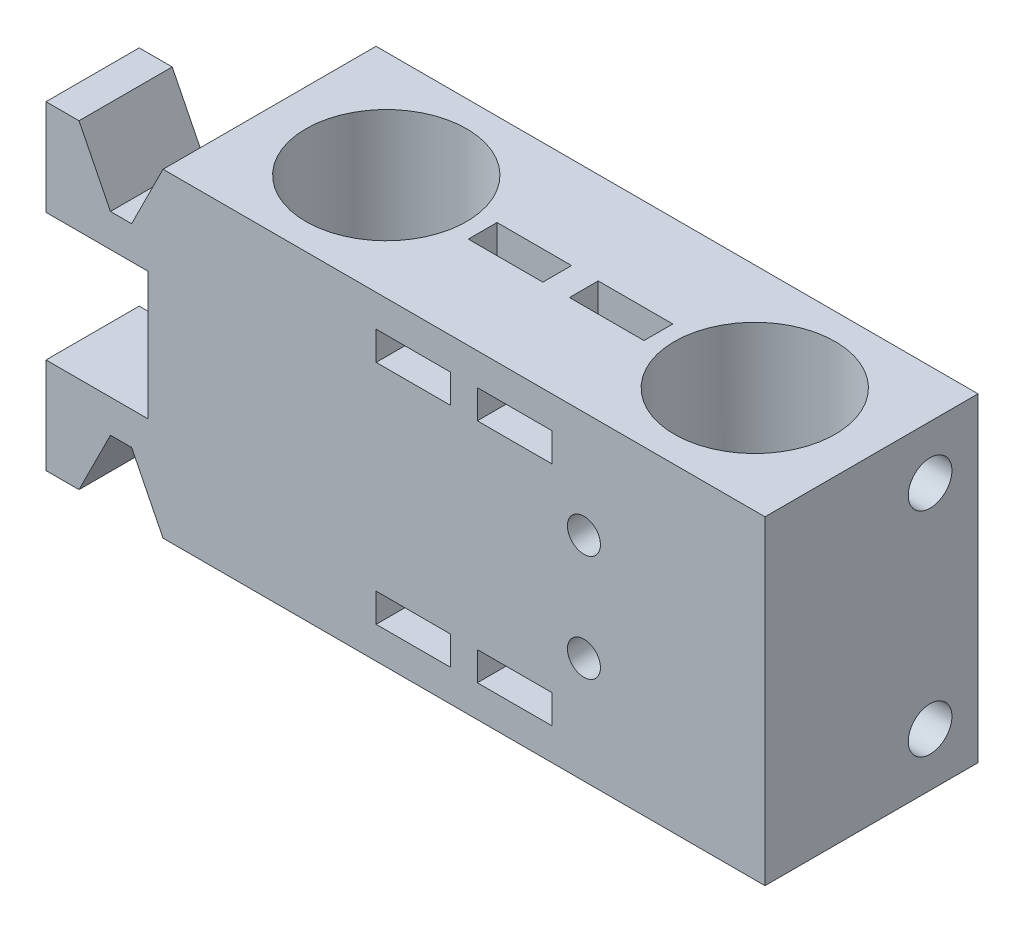
from build123d import *

# Parameters (mm, degrees)
BOSS_EXTRUDE1_DEPTH                     = 20
EARKNOTCH_SKETCH2_W                     = 10.99
EARKNOTCH_SKETCH2_H                     = 30
EARKNOTCH_CUT_EXTRUDE1_DEPTH            = 11.25
TOPHOLES_SKETCH3_R                      = 2.05
TOPHOLES_CUT_EXTRUDE2_DEPTH             = 4
FRONTHOLES_SKETCH1_R                    = 2.05
FRONTHOLES_CUT_EXTRUDE1_DEPTH           = 7
REARRIBBONHOLES_SKETCH2_W               = 7
REARRIBBONHOLES_SKETCH2_H               = 2.7
REARRIBBONHOLES_CUT_EXTRUDE1_DEPTH      = 11.35
RIGHTRIBBONHOLES_SKETCH4_W              = 7
RIGHTRIBBONHOLES_SKETCH4_H              = 2.7
RIGHTRIBBONHOLES_CUT_EXTRUDE2_DEPTH     = 5.7
LEFTRIBBONHOLES_SKETCH3_W               = 7
LEFTRIBBONHOLES_SKETCH3_H               = 2.7
LEFTRIBBONHOLES_CUT_EXTRUDE2_DEPTH      = 5.7
BOTTOMCLAMPMOUNTINGHOLESSKETCH3_R       = 2.05
BOTTOMCLAMPMOUNTHOLESCUT_EXTRUDE1_DEPTH = 4
LM8UUHOLESSKETCH1_R                     = 7.55
LM8UUCUT_EXTRUDE1_DEPTH                 = 77.534959986
RIBBONHOLEFILLET2_R                     = 2.7
RIBBONHOLEFILLET1_R                     = 2.7
RIBBONHOLEFILLET3_R                     = 2.7
RIBBONHOLEFILLET4_R                     = 2.7
PROBEMOUNTINGHOLESSKETCH1_R             = 1.55
PROBEMOUNTINGHOLESCUT_EXTRUDE1_DEPTH    = 3.1
LM8UUFASTENINGHOLESKETCH1_R             = 2.1
LM8UUFASTENINGHOLECUT_EXTRUDE1_DEPTH    = 14


with BuildPart() as part:
    # BackFace-Sketch1 → Boss-Extrude1 (new body)
    with BuildSketch(Plane.XY):
        Polygon((0, 0), (0, 9), (9.6, 9), (9.6, 21), (0, 21), (0, 30), (3.1, 30), (6.05, 24.095975949), (8.04, 24.095975949), (10.99, 30), (67.51, 30), (67.51, 0), (10.99, 0), (8.04, 5.904024051), (6.05, 5.904024051), (3.1, 0), align=None)
    extrude(amount=BOSS_EXTRUDE1_DEPTH)

    # EarKnotch-Sketch2 → EarKnotch-Cut-Extrude1 (cut)
    with BuildSketch(Plane(origin=(0, 0, 0), x_dir=(-1, 0, 0), z_dir=(0, 0, -1))):
        with Locations((-5.495, 15)):
            Rectangle(EARKNOTCH_SKETCH2_W, EARKNOTCH_SKETCH2_H)
    extrude(amount=-EARKNOTCH_CUT_EXTRUDE1_DEPTH, mode=Mode.SUBTRACT)

    # TopHoles-Sketch3 → TopHoles-Cut-Extrude2 (cut)
    with BuildSketch(Plane.ZY):
        with Locations((15.5, 25.5)):
            Circle(TOPHOLES_SKETCH3_R)
        with Locations((15.5, 4.5)):
            Circle(TOPHOLES_SKETCH3_R)
    extrude(amount=-TOPHOLES_CUT_EXTRUDE2_DEPTH, mode=Mode.SUBTRACT)

    # FrontHoles-Sketch1 → FrontHoles-Cut-Extrude1 (cut)
    with BuildSketch(Plane(origin=(0, 0, 0), x_dir=(-1, 0, 0), z_dir=(0, 0, -1))):
        with Locations((-43.86, 25)):
            Circle(FRONTHOLES_SKETCH1_R)
        with Locations((-43.86, 5)):
            Circle(FRONTHOLES_SKETCH1_R)
        with Locations((-31.86, 25)):
            Circle(FRONTHOLES_SKETCH1_R)
        with Locations((-31.86, 5)):
            Circle(FRONTHOLES_SKETCH1_R)
    extrude(amount=-FRONTHOLES_CUT_EXTRUDE1_DEPTH, mode=Mode.SUBTRACT)

    # RearRibbonHoles-Sketch2 → RearRibbonHoles-Cut-Extrude1 (cut)
    with BuildSketch(Plane.XY.offset(20)):
        with Locations((34.5, 25.65)):
            Rectangle(REARRIBBONHOLES_SKETCH2_W, REARRIBBONHOLES_SKETCH2_H)
        with Locations((44, 25.65)):
            Rectangle(REARRIBBONHOLES_SKETCH2_W, REARRIBBONHOLES_SKETCH2_H)
        with Locations((34.5, 4.35)):
            Rectangle(REARRIBBONHOLES_SKETCH2_W, REARRIBBONHOLES_SKETCH2_H)
        with Locations((44, 4.35)):
            Rectangle(REARRIBBONHOLES_SKETCH2_W, REARRIBBONHOLES_SKETCH2_H)
    extrude(amount=-REARRIBBONHOLES_CUT_EXTRUDE1_DEPTH, mode=Mode.SUBTRACT)

    # RightRibbonHoles-Sketch4 → RightRibbonHoles-Cut-Extrude2 (cut)
    with BuildSketch(Plane(origin=(0, 30, 0), x_dir=(1, 0, 0), z_dir=(0, 1, 0))):
        with Locations((34.5, -10)):
            Rectangle(RIGHTRIBBONHOLES_SKETCH4_W, RIGHTRIBBONHOLES_SKETCH4_H)
        with Locations((44, -10)):
            Rectangle(RIGHTRIBBONHOLES_SKETCH4_W, RIGHTRIBBONHOLES_SKETCH4_H)
    extrude(amount=-RIGHTRIBBONHOLES_CUT_EXTRUDE2_DEPTH, mode=Mode.SUBTRACT)

    # LeftRibbonHoles-Sketch3 → LeftRibbonHoles-Cut-Extrude2 (cut)
    with BuildSketch(Plane.XZ):
        with Locations((34.5, 10)):
            Rectangle(LEFTRIBBONHOLES_SKETCH3_W, LEFTRIBBONHOLES_SKETCH3_H)
        with Locations((44, 10)):
            Rectangle(LEFTRIBBONHOLES_SKETCH3_W, LEFTRIBBONHOLES_SKETCH3_H)
    extrude(amount=-LEFTRIBBONHOLES_CUT_EXTRUDE2_DEPTH, mode=Mode.SUBTRACT)

    # BottomClampMountingHolesSketch3 → BottomClampMountHolesCut-Extrude1 (cut)
    with BuildSketch(Plane(origin=(67.51, 0, 0), x_dir=(0, 0, -1), z_dir=(1, 0, 0))):
        with Locations((-4.5, 25)):
            Circle(BOTTOMCLAMPMOUNTINGHOLESSKETCH3_R)
        with Locations((-4.5, 5)):
            Circle(BOTTOMCLAMPMOUNTINGHOLESSKETCH3_R)
    extrude(amount=-BOTTOMCLAMPMOUNTHOLESCUT_EXTRUDE1_DEPTH, mode=Mode.SUBTRACT)

    # LM8UUHolesSketch1 → LM8UUCut-Extrude1 (cut, through all)
    with BuildSketch(Plane(origin=(0, 30, 0), x_dir=(1, 0, 0), z_dir=(0, 1, 0))):
        with Locations((21.95, -10)):
            Circle(LM8UUHOLESSKETCH1_R)
        with Locations((56.55, -10)):
            Circle(LM8UUHOLESSKETCH1_R)
    extrude(amount=-LM8UUCUT_EXTRUDE1_DEPTH, mode=Mode.SUBTRACT)

    # RibbonHoleFillet2
    ribbonholefillet2_edges = [part.edges().sort_by_distance(p)[0] for p in [
        (34.5, 5.7, 8.65),
    ]]
    fillet(ribbonholefillet2_edges, radius=RIBBONHOLEFILLET2_R)

    # RibbonHoleFillet1
    ribbonholefillet1_edges = [part.edges().sort_by_distance(p)[0] for p in [
        (44, 5.7, 8.65),
    ]]
    fillet(ribbonholefillet1_edges, radius=RIBBONHOLEFILLET1_R)

    # RibbonHoleFillet3
    ribbonholefillet3_edges = [part.edges().sort_by_distance(p)[0] for p in [
        (44, 24.3, 8.65),
    ]]
    fillet(ribbonholefillet3_edges, radius=RIBBONHOLEFILLET3_R)

    # RibbonHoleFillet4
    ribbonholefillet4_edges = [part.edges().sort_by_distance(p)[0] for p in [
        (34.5, 24.3, 8.65),
    ]]
    fillet(ribbonholefillet4_edges, radius=RIBBONHOLEFILLET4_R)

    # ProbeMountingHolesSketch1 → ProbeMountingHolesCut-Extrude1 (cut)
    with BuildSketch(Plane.XY.offset(20)):
        with Locations((50.51, 20)):
            Circle(PROBEMOUNTINGHOLESSKETCH1_R)
        with Locations((50.51, 10)):
            Circle(PROBEMOUNTINGHOLESSKETCH1_R)
    extrude(amount=-PROBEMOUNTINGHOLESCUT_EXTRUDE1_DEPTH, mode=Mode.SUBTRACT)

    # LM8UUFasteningHoleSketch1 → LM8UUFasteningHoleCut-Extrude1 (cut)
    with BuildSketch(Plane(origin=(0, 0, 0), x_dir=(-1, 0, 0), z_dir=(0, 0, -1))):
        with Locations((-30.55, 15)):
            Circle(LM8UUFASTENINGHOLESKETCH1_R)
        with Locations((-47.95, 15)):
            Circle(LM8UUFASTENINGHOLESKETCH1_R)
    extrude(amount=-LM8UUFASTENINGHOLECUT_EXTRUDE1_DEPTH, mode=Mode.SUBTRACT)


solid = part.part
